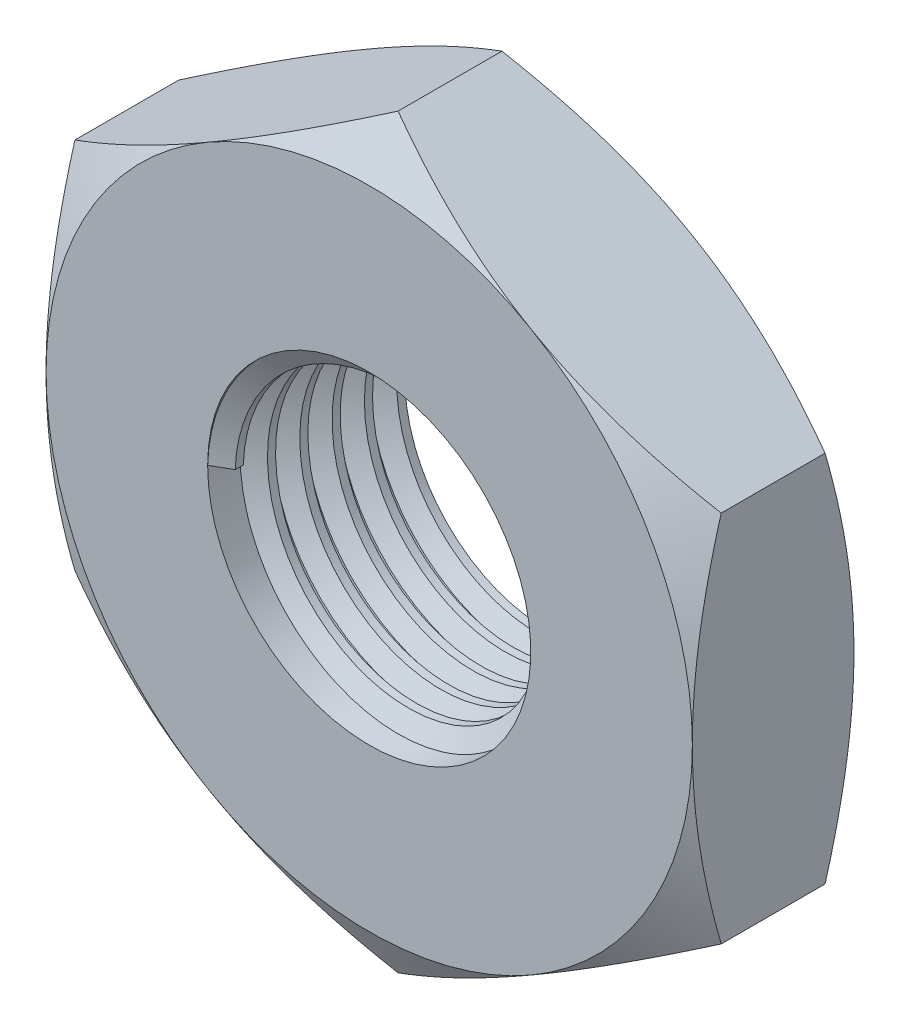
from build123d import *

# Parameters (mm, degrees)
SKETCH1_R               = 5
BOSS_EXTRUDE1_DEPTH     = 2.5
SKETCH2_OUTSIDE_W       = 87.334
SKETCH2_OUTSIDE_H       = 90.428
SKETCH2_OUTSIDE_R       = 10
CUT_EXTRUDE1_DEPTH      = 17.072751268
CUT_EXTRUDE1_DRAFT      = -60
MIRROR1_COPY_1_SKETCH_W = 87.334
MIRROR1_COPY_1_SKETCH_H = 90.428
MIRROR1_COPY_1_SKETCH_R = 10
MIRROR1_COPY_1_DEPTH    = 17.072751268
MIRROR1_COPY_1_DRAFT    = -60
THREAD1_PITCH           = 1


with BuildPart() as part:
    # Sketch1 → Boss-Extrude1 (new, symmetric)
    with BuildSketch(Plane.XY):
        Polygon((0, 11.547005384), (-10, 5.773502692), (-10, -5.773502692), (0, -11.547005384), (10, -5.773502692), (10, 5.773502692), align=None)
        Circle(SKETCH1_R, mode=Mode.SUBTRACT)
    extrude(amount=BOSS_EXTRUDE1_DEPTH, both=True)


with BuildPart() as cut_extrude1_tool:
    # Sketch2 outside → Cut-Extrude1 (with draft: the straight prism first)
    with BuildSketch(Plane.XY.offset(2.5)):
        Rectangle(SKETCH2_OUTSIDE_W, SKETCH2_OUTSIDE_H)
        Circle(SKETCH2_OUTSIDE_R, mode=Mode.SUBTRACT)
    extrude(amount=-CUT_EXTRUDE1_DEPTH)
    # Cut-Extrude1: the draft: its side faces are tilted about the plane it starts from
    cut_extrude1_sides = [cut_extrude1_tool.faces().sort_by_distance(p)[0] for p in [
        (0, -45.214, -6.036375634),
        (43.667, 0, -6.036375634),
        (0, 45.214, -6.036375634),
        (-43.667, 0, -6.036375634),
        (-10, 0, -6.036375634),
    ]]
    draft(cut_extrude1_sides, Plane.XY.offset(2.5), CUT_EXTRUDE1_DRAFT)


with BuildPart() as part_1:
    add(part.part)

    # Cut-Extrude1: cut by cut_extrude1_tool
    add(cut_extrude1_tool.part, mode=Mode.SUBTRACT)


with BuildPart() as mirror1_copy_1_tool:
    # Mirror1 copy 1 sketch → Mirror1 copy 1 (with draft: the straight prism first)
    with BuildSketch(Plane(origin=(0, 0, -2.5), x_dir=(1, 0, 0), z_dir=(0, 0, -1))):
        Rectangle(MIRROR1_COPY_1_SKETCH_W, MIRROR1_COPY_1_SKETCH_H)
        Circle(MIRROR1_COPY_1_SKETCH_R, mode=Mode.SUBTRACT)
    extrude(amount=-MIRROR1_COPY_1_DEPTH)
    # Mirror1 copy 1: the draft: its side faces are tilted about the plane it starts from
    mirror1_copy_1_sides = [mirror1_copy_1_tool.faces().sort_by_distance(p)[0] for p in [
        (0, -45.214, 6.036375634),
        (43.667, 0, 6.036375634),
        (0, 45.214, 6.036375634),
        (-43.667, 0, 6.036375634),
        (-10, 0, 6.036375634),
    ]]
    draft(mirror1_copy_1_sides, Plane(origin=(0, 0, -2.5), x_dir=(1, 0, 0), z_dir=(0, 0, -1)), MIRROR1_COPY_1_DRAFT)


with BuildPart() as part_2:
    add(part_1.part)

    # Mirror1 copy 1: cut by mirror1_copy_1_tool
    add(mirror1_copy_1_tool.part, mode=Mode.SUBTRACT)

    # Thread1: the profile of Thread Profile1 profile screwed along a right-hand helix of 5 turns, 8 arcs to a turn; built about Z, then put on its axis
    thread1_z = Axis((0, 0, 0), (0, 0, 1))
    thread1_corners = [(5.0003, 0, -0.000173205), (5.0003, 0, 0.875173202), (4.458734125, 0, 0.562499999), (4.458734125, 0, 0.312499999)]
    with BuildLine(mode=Mode.PRIVATE) as thread1_profile:
        Line(thread1_corners[0], thread1_corners[1])
        Line(thread1_corners[1], thread1_corners[2])
        Line(thread1_corners[2], thread1_corners[3])
        Line(thread1_corners[3], thread1_corners[0])
    thread1_cap = Face(thread1_profile.wire())
    thread1_turn_angles = [0, 22.5, 45, 67.5, 90, 112.5, 135, 157.5, 180, 202.5, 225, 247.5, 270, 292.5, 315, 337.5, 360]
    thread1_turn_weights = [1, 0.9238795325112867, 1, 0.9238795325112867, 1, 0.9238795325112867, 1, 0.9238795325112867, 1, 0.9238795325112867, 1, 0.9238795325112867, 1, 0.9238795325112867, 1, 0.9238795325112867, 1]
    thread1_turn_rails = [Edge.make_bspline([Vector(p[0], p[1], 0).rotate(thread1_z, thread1_turn_angles[k]) / thread1_turn_weights[k] + Vector(0, 0, p[2] + THREAD1_PITCH * thread1_turn_angles[k] / 360) for k in range(17)], [0, 0, 0, 1, 1, 2, 2, 3, 3, 4, 4, 5, 5, 6, 6, 7, 7, 8, 8, 8], 2, thread1_turn_weights) for p in thread1_corners]
    thread1_turn_sides = [Face.make_surface_from_curves(thread1_turn_rails[p[0]], thread1_turn_rails[p[1]]) for p in [(0, 1), (1, 2), (2, 3), (3, 0)]]
    thread1 = Plane(origin=(0, 0, 2.5), x_dir=(-1, 0, 0), z_dir=(0, 0, -1)) * Solid(Shell([*[p.moved(Location((0, 0, THREAD1_PITCH * i))) for i in range(5) for p in thread1_turn_sides], thread1_cap, thread1_cap.rotate(thread1_z, 1800).moved(Location((0, 0, THREAD1_PITCH * 1800 / 360)))]))
    add(thread1)


solid = part_2.part
